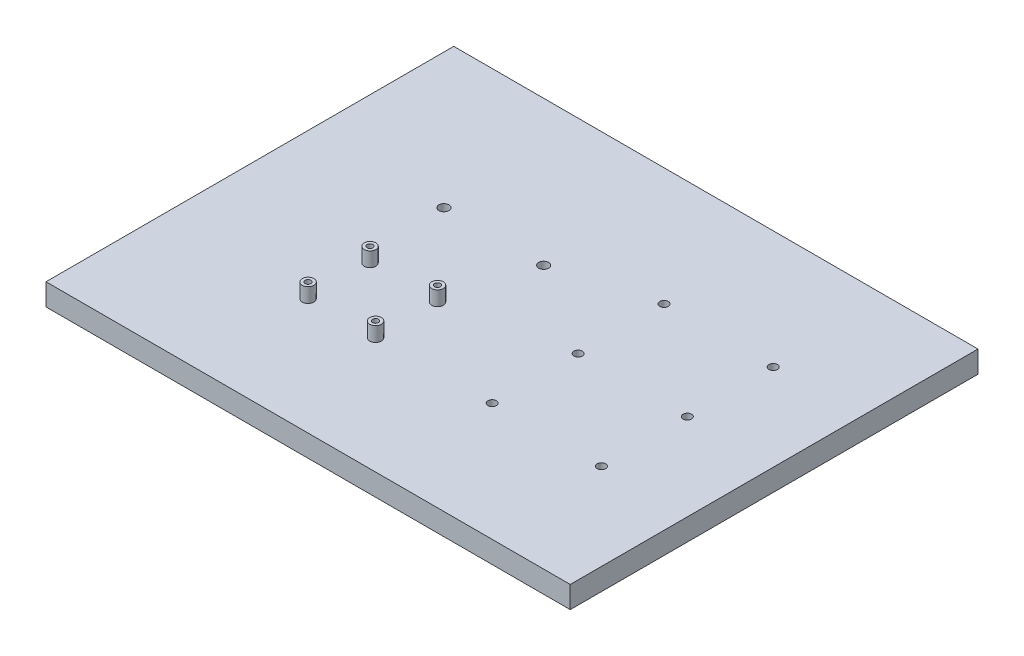
from build123d import *

# Parameters (mm, degrees)
SKETCH1_W           = 360
SKETCH1_H           = 280
BOSS_EXTRUDE1_DEPTH = 10
SKETCH2_W           = 360
SKETCH2_H           = 280
SKETCH2_R           = 2.925
SKETCH2_R_2         = 3.45
BOSS_EXTRUDE3_DEPTH = 5
SKETCH3_R           = 4
SKETCH3_R_2         = 2
BOSS_EXTRUDE4_DEPTH = 10


with BuildPart() as part:
    # Sketch1 → Boss-Extrude1 (new body)
    with BuildSketch(Plane(origin=(0, 0, 0), x_dir=(1, 0, 0), z_dir=(0, 1, 0))):
        with Locations((180, 140)):
            Rectangle(SKETCH1_W, SKETCH1_H)
    extrude(amount=BOSS_EXTRUDE1_DEPTH)

    # Sketch2 → Boss-Extrude3 (add)
    with BuildSketch(Plane(origin=(0, 10, 0), x_dir=(1, 0, 0), z_dir=(0, 1, 0))):
        with Locations((180, 140)):
            Rectangle(SKETCH2_W, SKETCH2_H)
        with Locations((225.395194173, 81)):
            Circle(SKETCH2_R, mode=Mode.SUBTRACT)
        with Locations((300.395194173, 81)):
            Circle(SKETCH2_R, mode=Mode.SUBTRACT)
        with Locations((92.580458867, 180.656389696)):
            Circle(SKETCH2_R_2, mode=Mode.SUBTRACT)
        with Locations((161.080458867, 180.656389696)):
            Circle(SKETCH2_R_2, mode=Mode.SUBTRACT)
        with Locations((225.395194173, 140)):
            Circle(SKETCH2_R, mode=Mode.SUBTRACT)
        with Locations((225.395194173, 199)):
            Circle(SKETCH2_R, mode=Mode.SUBTRACT)
        with Locations((300.395194173, 140)):
            Circle(SKETCH2_R, mode=Mode.SUBTRACT)
        with Locations((300.395194173, 199)):
            Circle(SKETCH2_R, mode=Mode.SUBTRACT)
    extrude(amount=BOSS_EXTRUDE3_DEPTH)

    # Sketch3 → Boss-Extrude4 (add)
    # profile 1 of 4: a face of its own
    with BuildSketch(Plane(origin=(0, 15, 0), x_dir=(1, 0, 0), z_dir=(0, 1, 0))):
        with Locations((100.077958807, 79.881235755)):
            Circle(SKETCH3_R)
        with Locations((100.077958807, 79.881235755)):
            Circle(SKETCH3_R_2, mode=Mode.SUBTRACT)
    # profile 2 of 4: a face of its own
    with BuildSketch(Plane(origin=(0, 15, 0), x_dir=(1, 0, 0), z_dir=(0, 1, 0))):
        with Locations((100.077958807, 122.426235755)):
            Circle(SKETCH3_R)
        with Locations((100.077958807, 122.426235755)):
            Circle(SKETCH3_R_2, mode=Mode.SUBTRACT)
    # profile 3 of 4: a face of its own
    with BuildSketch(Plane(origin=(0, 15, 0), x_dir=(1, 0, 0), z_dir=(0, 1, 0))):
        with Locations((146.432958807, 122.426235755)):
            Circle(SKETCH3_R)
        with Locations((146.432958807, 122.426235755)):
            Circle(SKETCH3_R_2, mode=Mode.SUBTRACT)
    # profile 4 of 4: a face of its own
    with BuildSketch(Plane(origin=(0, 15, 0), x_dir=(1, 0, 0), z_dir=(0, 1, 0))):
        with Locations((146.432958807, 79.881235755)):
            Circle(SKETCH3_R)
        with Locations((146.432958807, 79.881235755)):
            Circle(SKETCH3_R_2, mode=Mode.SUBTRACT)
    extrude(amount=BOSS_EXTRUDE4_DEPTH)


solid = part.part
